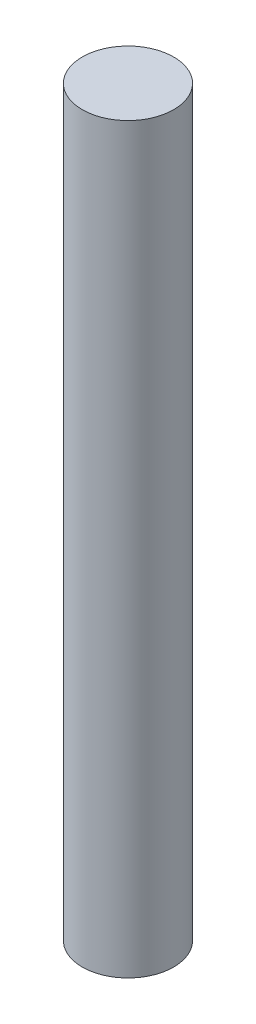
from build123d import *

# Parameters (mm, degrees)
SKETCH_1_R      = 4
EXTRUDE_1_DEPTH = 65


with BuildPart() as part:
    # Эскиз1 → Бобышка-Вытянуть1 (new body)
    with BuildSketch(Plane(origin=(0, 0, 0), x_dir=(1, 0, 0), z_dir=(0, 1, 0))):
        Circle(SKETCH_1_R)
    extrude(amount=EXTRUDE_1_DEPTH)


solid = part.part
